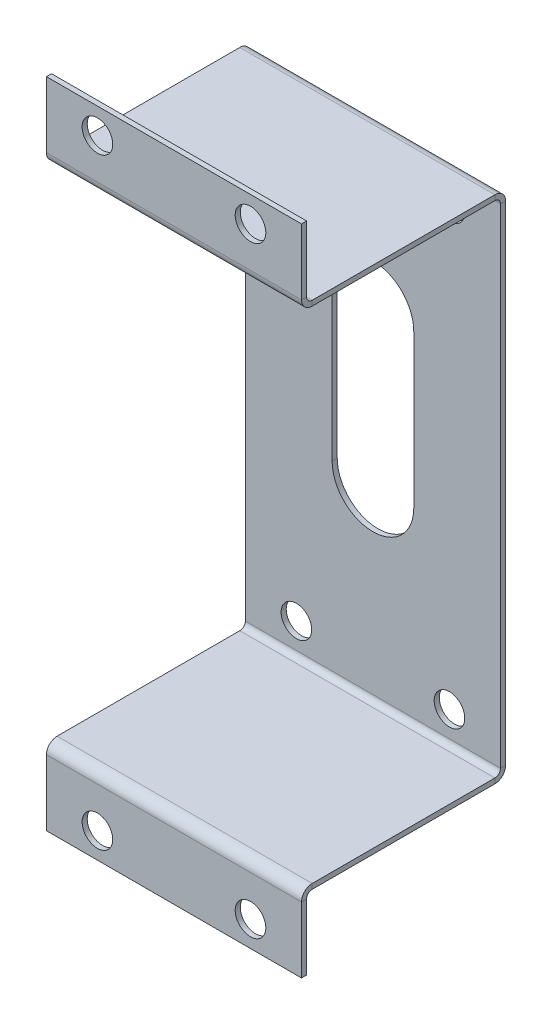
from build123d import *

# Parameters (mm, degrees)
SKETCH3_W                      = 50
SKETCH3_H                      = 100
BASE_FLANGE1_DEPTH             = 1
EDGE_FLANGE1_STRIP_W           = 6.2
EDGE_FLANGE1_STRIP_H           = 1
EDGE_FLANGE1_STRIP_CUT_DEPTH   = 50
EDGE_FLANGE1_STRIP_2_W         = 6.2
EDGE_FLANGE1_STRIP_2_H         = 1
EDGE_FLANGE1_STRIP_CUT_2_DEPTH = 50
EDGE_FLANGE1_DEPTH             = 50
EDGE_FLANGE1_BEND_DEPTH        = 50
EDGE_FLANGE2_STRIP_W           = 6.2
EDGE_FLANGE2_STRIP_H           = 1
EDGE_FLANGE2_STRIP_CUT_DEPTH   = 50
EDGE_FLANGE2_STRIP_2_W         = 6.2
EDGE_FLANGE2_STRIP_2_H         = 1
EDGE_FLANGE2_STRIP_CUT_2_DEPTH = 50
EDGE_FLANGE2_DEPTH             = 50
EDGE_FLANGE2_BEND_DEPTH        = 50
SKETCH20_R                     = 3
CUT_EXTRUDE1_DEPTH             = 94


# Sheet-metal steps are written as plain solids
with BuildPart() as part:
    # Sketch3 → Base-Flange1 (new body)
    with BuildSketch(Plane.XY):
        Rectangle(SKETCH3_W, SKETCH3_H)
    extrude(amount=-BASE_FLANGE1_DEPTH)

    # Edge-Flange1 strip (across the edge) → Edge-Flange1 strip cut (cut)
    with BuildSketch(Plane(origin=(-25, -50, 0), x_dir=(0, 1, 0), z_dir=(1, 0, 0))):
        with Locations((-1, -0.5)):
            Rectangle(EDGE_FLANGE1_STRIP_W, EDGE_FLANGE1_STRIP_H)
    extrude(amount=EDGE_FLANGE1_STRIP_CUT_DEPTH, mode=Mode.SUBTRACT)

    # Edge-Flange1 strip 2 (across the edge) → Edge-Flange1 strip cut 2 (cut)
    with BuildSketch(Plane(origin=(25, 50, 0), x_dir=(0, -1, 0), z_dir=(-1, 0, 0))):
        with Locations((-1, -0.5)):
            Rectangle(EDGE_FLANGE1_STRIP_2_W, EDGE_FLANGE1_STRIP_2_H)
    extrude(amount=EDGE_FLANGE1_STRIP_CUT_2_DEPTH, mode=Mode.SUBTRACT)

    # Edge-Flange1 section (across the edge) → Edge-Flange1 (add)
    with BuildSketch(Plane(origin=(-25, -50, 0), x_dir=(0, 1, 0), z_dir=(1, 0, 0))):
        with BuildLine():
            Line((0, 1.1), (0, 39))
            Line((0, 39), (1, 39))
            Line((1, 39), (1, 1.1))
            ThreePointArc((1, 1.1), (1.322182541, 0.322182541), (2.1, 0))
            Line((2.1, 0), (2.1, -1))
            ThreePointArc((2.1, -1), (0.61507576, -0.38492424), (0, 1.1))
        make_face()
    extrude(amount=EDGE_FLANGE1_DEPTH)

    # Edge-Flange1 section 2 (across the edge) → Edge-Flange1 bend (add)
    with BuildSketch(Plane(origin=(25, 50, 0), x_dir=(0, -1, 0), z_dir=(-1, 0, 0))):
        with BuildLine():
            Line((0, 1.1), (0, 39))
            Line((0, 39), (1, 39))
            Line((1, 39), (1, 1.1))
            ThreePointArc((1, 1.1), (1.322182541, 0.322182541), (2.1, 0))
            Line((2.1, 0), (2.1, -1))
            ThreePointArc((2.1, -1), (0.61507576, -0.38492424), (0, 1.1))
        make_face()
    extrude(amount=EDGE_FLANGE1_BEND_DEPTH)

    # Edge-Flange2 strip (across the edge) → Edge-Flange2 strip cut (cut)
    with BuildSketch(Plane(origin=(25, -50, 39), x_dir=(0, 0, -1), z_dir=(-1, 0, 0))):
        with Locations((-1, -0.5)):
            Rectangle(EDGE_FLANGE2_STRIP_W, EDGE_FLANGE2_STRIP_H)
    extrude(amount=EDGE_FLANGE2_STRIP_CUT_DEPTH, mode=Mode.SUBTRACT)

    # Edge-Flange2 strip 2 (across the edge) → Edge-Flange2 strip cut 2 (cut)
    with BuildSketch(Plane(origin=(-25, 50, 39), x_dir=(0, 0, -1), z_dir=(1, 0, 0))):
        with Locations((-1, -0.5)):
            Rectangle(EDGE_FLANGE2_STRIP_2_W, EDGE_FLANGE2_STRIP_2_H)
    extrude(amount=EDGE_FLANGE2_STRIP_CUT_2_DEPTH, mode=Mode.SUBTRACT)

    # Edge-Flange2 section (across the edge) → Edge-Flange2 (add)
    with BuildSketch(Plane(origin=(25, -50, 39), x_dir=(0, 0, -1), z_dir=(-1, 0, 0))):
        with BuildLine():
            Line((0, 1.1), (0, 14))
            Line((0, 14), (1, 14))
            Line((1, 14), (1, 1.1))
            ThreePointArc((1, 1.1), (1.322182541, 0.322182541), (2.1, 0))
            Line((2.1, 0), (2.1, -1))
            ThreePointArc((2.1, -1), (0.61507576, -0.38492424), (0, 1.1))
        make_face()
    extrude(amount=EDGE_FLANGE2_DEPTH)

    # Edge-Flange2 section 2 (across the edge) → Edge-Flange2 bend (add)
    with BuildSketch(Plane(origin=(-25, 50, 39), x_dir=(0, 0, -1), z_dir=(1, 0, 0))):
        with BuildLine():
            Line((0, 1.1), (0, 14))
            Line((0, 14), (1, 14))
            Line((1, 14), (1, 1.1))
            ThreePointArc((1, 1.1), (1.322182541, 0.322182541), (2.1, 0))
            Line((2.1, 0), (2.1, -1))
            ThreePointArc((2.1, -1), (0.61507576, -0.38492424), (0, 1.1))
        make_face()
    extrude(amount=EDGE_FLANGE2_BEND_DEPTH)

    # Sketch20 → Cut-Extrude1 (cut)
    with BuildSketch(Plane(origin=(0, 0, -1), x_dir=(-1, 0, 0), z_dir=(0, 0, -1))):
        with Locations((15, 42.9)):
            Circle(SKETCH20_R)
        with Locations((-15, 42.9)):
            Circle(SKETCH20_R)
        with Locations((15, 59)):
            Circle(SKETCH20_R)
        with Locations((-15, 59)):
            Circle(SKETCH20_R)
        with Locations((-15, -59)):
            Circle(SKETCH20_R)
        with Locations((15, -59)):
            Circle(SKETCH20_R)
        with Locations((15, -42.9)):
            Circle(SKETCH20_R)
        with Locations((-15, -42.9)):
            Circle(SKETCH20_R)
        with BuildLine():
            Line((8, 17.746865737), (8, -12.253134263))
            ThreePointArc((8, -12.253134263), (0, -20.253134263), (-8, -12.253134263))
            Line((-8, -12.253134263), (-8, 17.746865737))
            ThreePointArc((-8, 17.746865737), (0, 25.746865737), (8, 17.746865737))
        make_face()
    extrude(amount=-CUT_EXTRUDE1_DEPTH, mode=Mode.SUBTRACT)


solid = part.part
